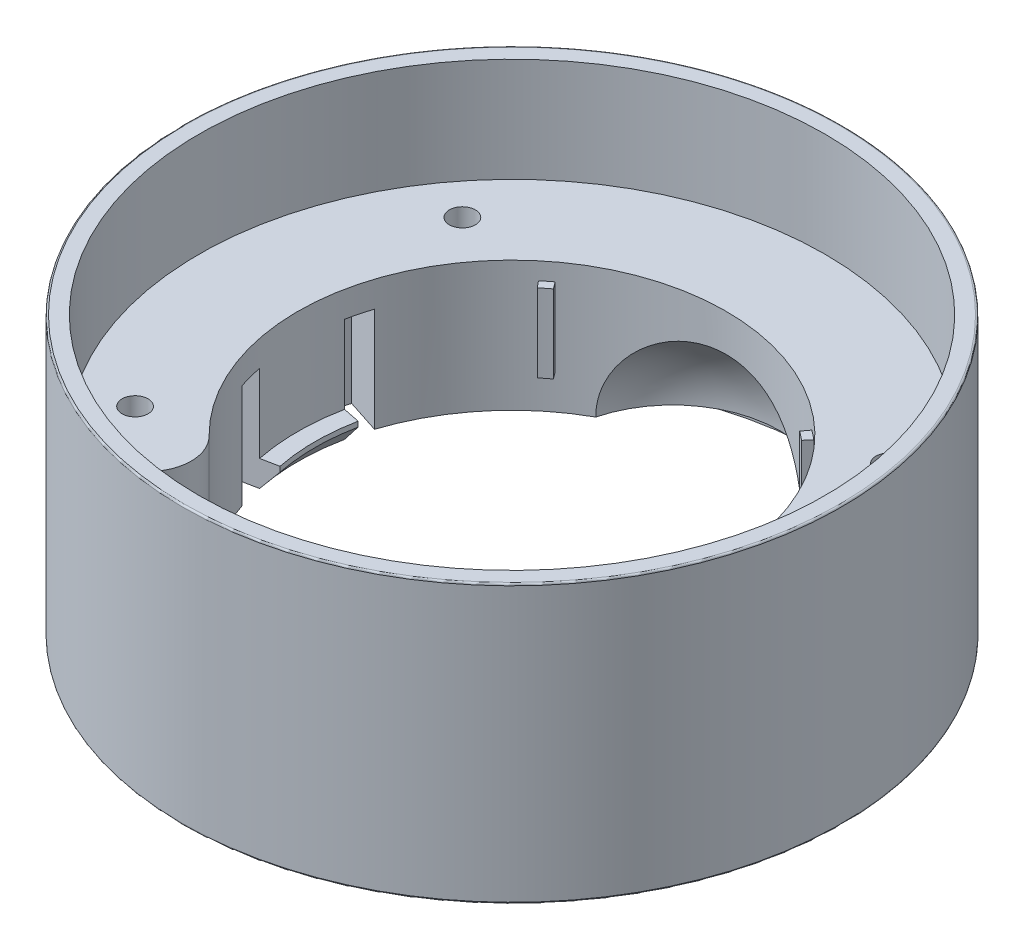
from build123d import *

# Parameters (mm, degrees)
EXTRUDE_1_DEPTH                = 13.5
EXTRUDE_1_DEPTH_BACK           = 2.5
SKETCH_1_R                     = 19
SKETCH_2_R                     = 18.05
CUT_EXTRUDE_1_DEPTH            = 6
CUT_EXTRUDE_START              = -2.5
SKETCH_3_R                     = 18.05
CUT_EXTRUDE_2_DEPTH            = 2.5
SKETCH_4_R                     = 12.35
CUT_EXTRUDE_3_DEPTH            = 11
EXTRUDE_2_DEPTH                = 1.5
EXTRUDE_START                  = -0.5
EXTRUDE_3_DEPTH                = 4.5
CUT_EXTRUDE_4_DEPTH            = 6
EXTRUDE_4_DEPTH                = 1.5
CUT_REVOLVE_12_ANGLE           = 45.0000000000001
CUT_REVOLVE_12_OTHER_WAY_ANGLE = 225.0000000000005
CUT_EXTRUDE_5_DEPTH            = 2.5
EXTRUDE_5_DEPTH                = 0.6
FILLET_11_SIZE                 = 0.4
FILLET_11_SIZE_2               = 1
CUT_EXTRUDE_START_2            = -5
CUT_EXTRUDE_6_DEPTH            = 5
FILLET_13_R                    = 2.5
HOLE_WIZARD_1_5_1_5_1_D        = 1.5
HOLE_WIZARD_1_5_1_5_1_DEPTH    = 2
HOLE_WIZARD_1_5_1_5_1_TIP      = 0.4506454642706702
FILLET_6_R                     = 0.1
FILLET_14_R                    = 0.3


with BuildPart() as part:
    # 草图1 → 凸台-拉伸1 (new, two sides: drawn at the far end of the back side and taken through both)
    with BuildSketch(Plane(origin=(0, 0, 0), x_dir=(1, 0, 0), z_dir=(0, 1, 0)).offset(-EXTRUDE_1_DEPTH_BACK)):
        with Locations(Location((0, 0, 0), (0, 0, 270))):
            Circle(SKETCH_1_R)
    extrude(amount=EXTRUDE_1_DEPTH + EXTRUDE_1_DEPTH_BACK)

    # 草图2 → 切除-拉伸1 (cut)
    with BuildSketch(Plane(origin=(0, 13.5, 0), x_dir=(1, 0, 0), z_dir=(0, 1, 0))):
        with Locations(Location((0, 0, 0), (0, 0, 270))):
            Circle(SKETCH_2_R)
    extrude(amount=-CUT_EXTRUDE_1_DEPTH, mode=Mode.SUBTRACT)

    # 草图3 → 切除-拉伸2 (cut)
    with BuildSketch(Plane(origin=(0, -2.5, 0), x_dir=(-1, 0, 0), z_dir=(0, -1, 0)).offset(CUT_EXTRUDE_START)):
        with Locations(Location((0, 0, 0), (0, 0, 270))):
            Circle(SKETCH_3_R)
    extrude(amount=CUT_EXTRUDE_2_DEPTH, mode=Mode.SUBTRACT)

    # 草图4 → 切除-拉伸3 (cut)
    with BuildSketch(Plane(origin=(0, -2.5, 0), x_dir=(-1, 0, 0), z_dir=(0, -1, 0))):
        with Locations(Location((0, 0, 0), (0, 0, 90))):
            Circle(SKETCH_4_R)
    extrude(amount=-CUT_EXTRUDE_3_DEPTH, mode=Mode.SUBTRACT)

    # 草图6 → 切除-旋转1 (revolve, cut)
    with BuildSketch(Plane.XY, mode=Mode.PRIVATE) as cut_revolve_1_sk:
        with BuildLine():
            Line((-17.5, 0.09999999999999791), (-17.5, -1e-17))
            Line((-17.5, -1e-17), (-16.2, -1e-17))
            Line((-16.2, -1e-17), (-16.2, 0.09999999999999802))
            ThreePointArc((-16.2, 0.09999999999999802), (-16.85, 0.7499999999999966), (-17.5, 0.09999999999999791))
        make_face()
    revolve(cut_revolve_1_sk.sketch.rotate(Axis((0, 0, 0), (0, 1, 0)), 270), axis=Axis((0, 0, 0), (0, 1, 0)), mode=Mode.SUBTRACT)

    # 草图8 → 凸台-拉伸2 (add)
    with BuildSketch(Plane(origin=(0, 0, 0), x_dir=(1, 0, 0), z_dir=(0, 1, 0))):
        with BuildLine():
            Line((-7.083668988935433, -10.116527746969041), (7.083668988935436, -10.116527746969041))
            ThreePointArc((7.083668988935436, -10.116527746969041), (7.6e-16, -12.350000000000001), (-7.083668988935433, -10.116527746969041))
        make_face()
    extrude(amount=EXTRUDE_2_DEPTH)

    # 草图10 → 凸台-拉伸3 (add)
    with BuildSketch(Plane(origin=(0, 1.5, 0), x_dir=(-1, 0, 0), z_dir=(0, -1, 0)).offset(EXTRUDE_START)):
        with BuildLine():
            Line((-7.938426979628755, 9.460648872519387), (-7.617033174785484, 9.077626650959896))
            ThreePointArc((-7.617033174785484, 9.077626650959896), (-7.36186118424343, 9.285768675986384), (-7.101004280987901, 9.486740125111023))
            Line((-7.101004280987901, 9.486740125111023), (-7.400624714784859, 9.887024518575625))
            ThreePointArc((-7.400624714784859, 9.887024518575625), (-7.672488238430918, 9.677573261471045), (-7.938426979628755, 9.460648872519387))
        make_face()
        with BuildLine():
            Line((7.938426979628755, 9.460648872519387), (7.617033174785484, 9.077626650959896))
            ThreePointArc((7.617033174785484, 9.077626650959896), (7.36186118424343, 9.285768675986384), (7.101004280987901, 9.486740125111023))
            Line((7.101004280987901, 9.486740125111023), (7.400624714784859, 9.887024518575625))
            ThreePointArc((7.400624714784859, 9.887024518575625), (7.672488238430917, 9.677573261471045), (7.938426979628755, 9.460648872519387))
        make_face()
    extrude(amount=-EXTRUDE_3_DEPTH)

    # 草图11 → 切除-旋转10 (revolve, cut)
    with BuildSketch(Plane(origin=(0, 0, 0), x_dir=(1, 0, 0), z_dir=(0, 1, 0))):
        with BuildLine():
            Line((-5.978918040707698, 10.806250000000004), (5.978918040707698, 10.806250000000004))
            ThreePointArc((5.978918040707698, 10.806250000000004), (3.8e-16, 15.437499999999998), (-5.978918040707698, 10.806250000000004))
        make_face()
    revolve(axis=Axis((0, 0, -9.2625), (-1, 0, 0)), mode=Mode.SUBTRACT)

    # 草图12 → 切除-拉伸4 (cut)
    with BuildSketch(Plane(origin=(0, 0, 0), x_dir=(1, 0, 0), z_dir=(0, 1, 0))):
        with BuildLine():
            Line((-11.74554797624514, -3.8163598805306145), (-12.104483802376642, -2.4503003648535713))
            Line((-12.104483802376642, -2.4503003648535713), (-13.035597941020999, -2.6387850083038455))
            ThreePointArc((-13.035597941020999, -2.6387850083038455), (-13.3, -1.63e-15), (-13.035597941020999, 2.6387850083038424))
            Line((-13.035597941020999, 2.6387850083038424), (-12.104483802376642, 2.4503003648535713))
            Line((-12.104483802376642, 2.4503003648535713), (-11.74554797624514, 3.8163598805306145))
            Line((-11.74554797624514, 3.8163598805306145), (-13.695213834650207, 4.449844718999256))
            ThreePointArc((-13.695213834650207, 4.449844718999256), (-14.4, -8.16e-15), (-13.695213834650206, -4.44984471899926))
            Line((-13.695213834650206, -4.44984471899926), (-11.74554797624514, -3.8163598805306145))
        make_face()
        with BuildLine():
            Line((13.695213834650206, -4.449844718999256), (11.74554797624514, -3.8163598805306145))
            Line((11.74554797624514, -3.8163598805306145), (12.104483802376642, -2.4503003648535713))
            Line((12.104483802376642, -2.4503003648535713), (13.035597941020999, -2.638785008303843))
            ThreePointArc((13.035597941020999, -2.638785008303843), (13.3, 1.11e-15), (13.035597941020999, 2.638785008303845))
            Line((13.035597941020999, 2.638785008303845), (12.104483802376642, 2.4503003648535713))
            Line((12.104483802376642, 2.4503003648535713), (11.74554797624514, 3.8163598805306145))
            Line((11.74554797624514, 3.8163598805306145), (13.695213834650207, 4.44984471899926))
            ThreePointArc((13.695213834650207, 4.44984471899926), (14.399999999999999, 1.6e-15), (13.695213834650206, -4.449844718999256))
        make_face()
    extrude(amount=CUT_EXTRUDE_4_DEPTH, mode=Mode.SUBTRACT)

    # 草图14 → 凸台-拉伸4 (add)
    with BuildSketch(Plane(origin=(0, 0, 0), x_dir=(1, 0, 0), z_dir=(0, 1, 0))):
        with BuildLine():
            ThreePointArc((11.12436365643521, -2.2518954770111765), (11.349999999999998, -1.58e-15), (11.12436365643521, 2.251895477011174))
            Line((11.12436365643521, 2.251895477011174), (12.104483802376642, 2.4503003648535713))
            ThreePointArc((12.104483802376642, 2.4503003648535713), (12.35, 0), (12.10448380237664, -2.450300364853571))
            Line((12.10448380237664, -2.450300364853571), (11.12436365643521, -2.2518954770111765))
        make_face()
        with BuildLine():
            Line((-12.104483802376642, 2.4503003648535713), (-11.12436365643521, 2.251895477011174))
            ThreePointArc((-11.12436365643521, 2.251895477011174), (-11.349999999999998, -6.43e-15), (-11.12436365643521, -2.2518954770111765))
            Line((-11.12436365643521, -2.2518954770111765), (-12.10448380237664, -2.450300364853571))
            ThreePointArc((-12.10448380237664, -2.450300364853571), (-12.35, -1.51e-15), (-12.104483802376642, 2.4503003648535713))
        make_face()
    extrude(amount=EXTRUDE_4_DEPTH)

    # 草图17 → 切除-旋转12 (revolve, cut)
    with BuildSketch(Plane.XY):
        Polygon((-11.35, 0), (-11.35, 1.2039032637703866), (-12.35, -1.2e-16), align=None)
    revolve(axis=Axis((0, 0, 0), (0, 1, 0)), revolution_arc=CUT_REVOLVE_12_ANGLE, mode=Mode.SUBTRACT)

    # 草图17 → 切除-旋转12 other way (revolve, cut)
    with BuildSketch(Plane.XY):
        Polygon((-11.35, 0), (-11.35, 1.2039032637703866), (-12.35, -1.2e-16), align=None)
    revolve(axis=Axis((0, 0, 0), (0, -1, 0)), revolution_arc=CUT_REVOLVE_12_OTHER_WAY_ANGLE, mode=Mode.SUBTRACT)

    # 草图18 → 切除-拉伸5 (cut)
    with BuildSketch(Plane(origin=(0, 0, 0), x_dir=(1, 0, 0), z_dir=(0, 1, 0))):
        with BuildLine():
            Line((-9.641814145309109, -11.490666646775422), (-8.3240995454502, -9.920275538382782))
            ThreePointArc((-8.3240995454502, -9.920275538382782), (-10.13477563124262, -8.061564544452322), (-11.538534488239353, -5.879176971627146))
            Line((-11.538534488239353, -5.879176971627146), (-13.365097862825511, -6.809857496093215))
            ThreePointArc((-13.365097862825511, -6.809857496093215), (-11.739122352790682, -9.337719549558669), (-9.641814145309109, -11.490666646775422))
        make_face()
        with BuildLine():
            Line((-10.036959095382924, 11.147172382160871), (-8.665241352347259, 9.623725489932214))
            ThreePointArc((-8.665241352347259, 9.623725489932214), (-10.4099463449893, 7.7029550884348215), (-11.736685842119385, 5.472906489553279))
            Line((-11.736685842119385, 5.472906489553279), (-13.59461680554369, 6.339273926123483))
            ThreePointArc((-13.59461680554369, 6.339273926123483), (-12.057852909254018, 8.922341801275856), (-10.036959095382924, 11.147172382160871))
        make_face()
        with BuildLine():
            Line((13.365097862825559, 6.809857496093119), (11.538534488239392, 5.879176971627067))
            ThreePointArc((11.538534488239392, 5.879176971627067), (10.134775631242675, 8.061564544452253), (8.324099545450267, 9.920275538382725))
            Line((8.324099545450267, 9.920275538382725), (9.641814145309189, 11.490666646775352))
            ThreePointArc((9.641814145309189, 11.490666646775352), (11.739122352790748, 9.337719549558585), (13.365097862825559, 6.809857496093119))
        make_face()
        with BuildLine():
            Line((10.036959095382016, -11.147172382161688), (8.665241352346477, -9.623725489932918))
            ThreePointArc((8.665241352346477, -9.623725489932918), (10.409946344988674, -7.702955088435669), (11.73668584211894, -5.4729064895542345))
            Line((11.73668584211894, -5.4729064895542345), (13.594616805543174, -6.339273926124587))
            ThreePointArc((13.594616805543174, -6.339273926124587), (12.057852909253292, -8.922341801276836), (10.036959095382016, -11.147172382161688))
        make_face()
    extrude(amount=CUT_EXTRUDE_5_DEPTH, mode=Mode.SUBTRACT)

    # 草图19 → 凸台-拉伸5 (add)
    with BuildSketch(Plane(origin=(0, 0, 0), x_dir=(1, 0, 0), z_dir=(0, 1, 0))):
        with BuildLine():
            ThreePointArc((-10.95651419593377, -8.715204912926694), (-10.02822720794983, -9.76906643777872), (-8.999026535621834, -10.72462220365706))
            Line((-8.999026535621836, -10.724622203657061), (-8.3240995454502, -9.920275538382782))
            ThreePointArc((-8.3240995454502, -9.920275538382782), (-9.276110167353597, -9.036386454945319), (-10.134775631238742, -8.061564544457195))
            Line((-10.134775631238744, -8.061564544457193), (-10.956514195933774, -8.715204912926694))
        make_face()
        with BuildLine():
            ThreePointArc((-11.253996048641035, 8.327519014518785), (-12.031689761016896, 7.15810320508452), (-12.688309018507407, 5.916655664381993))
            Line((-12.68830901850741, 5.916655664381995), (-11.736685842119355, 5.472906489553341))
            ThreePointArc((-11.736685842119355, 5.472906489553342), (-11.12931302894063, 6.621245464703179), (-10.409946344992958, 7.702955088429878))
            Line((-10.409946344992958, 7.702955088429876), (-11.253996048641037, 8.327519014518785))
        make_face()
        with BuildLine():
            ThreePointArc((11.253996048640747, -8.327519014519178), (12.031689761016644, -7.158103205084936), (12.688309018507205, -5.916655664382435))
            Line((12.688309018507203, -5.916655664382435), (11.736685842119163, -5.472906489553754))
            ThreePointArc((11.736685842119165, -5.472906489553755), (11.129313028940397, -6.621245464703571), (10.40994634499269, -7.702955088430243))
            Line((10.409946344992687, -7.702955088430242), (11.253996048640747, -8.327519014519176))
        make_face()
        with BuildLine():
            ThreePointArc((10.956514195934083, 8.71520491292631), (10.02822720795018, 9.76906643777837), (8.999026535622212, 10.724622203656743))
            Line((8.999026535622214, 10.724622203656743), (8.324099545450547, 9.920275538382489))
            ThreePointArc((8.324099545450547, 9.920275538382489), (9.276110167353913, 9.036386454944992), (10.134775631239028, 8.061564544456838))
            Line((10.134775631239027, 8.061564544456838), (10.956514195934083, 8.71520491292631))
        make_face()
    extrude(amount=EXTRUDE_5_DEPTH)

    # 圆角11
    # an asymmetric fillet: 1, 0.4 mm, written as the material it takes off along each edge
    with BuildSketch(Plane(origin=(-8.178255239107715, 0.6, 6.505277952863138), x_dir=(-1.08e-15, -1, -1.36e-15), z_dir=(-0.7826081568524119, 0, 0.6225146366376222))) as fillet_11_piece_1_section:
        with BuildLine():
            Bezier((FILLET_11_SIZE, 0), (0, -7e-16), (-1.74e-15, FILLET_11_SIZE_2), weights=[1, 0.7071067811865476, 1])
            Line((-1.74e-15, FILLET_11_SIZE_2), (0, 0))
            Line((0, 0), (FILLET_11_SIZE, 0))
        make_face()
    fillet_11_piece_1 = extrude(amount=6.049999999999995, mode=Mode.PRIVATE)
    fillet_11_piece_1 = fillet_11_piece_1 - Plane(origin=(-1.2612e-13, 0.5106656532216078, 1.1058e-13), x_dir=(-0.6427876096872726, 0, 0.7660444431183628), z_dir=(0, -1, 0)) * Cylinder(12.949999999999834, 17, mode=Mode.PRIVATE)
    fillet_11_piece_1 = fillet_11_piece_1 & Plane(origin=(1.5454e-13, 0.5106656532216078, -1.3323e-13), x_dir=(-0.7826081568524123, 0, 0.6225146366376217), z_dir=(0, -1, 0)) * Cylinder(14.000000000000197, 17, mode=Mode.PRIVATE)
    add(fillet_11_piece_1, mode=Mode.SUBTRACT)
    with BuildSketch(Plane(origin=(8.17825523910794, 0.6, -6.505277952862855), x_dir=(-1.08e-15, -1, -1.36e-15), z_dir=(0.7826081568524349, 0, -0.6225146366375932))) as fillet_11_piece_2_section:
        with BuildLine():
            Bezier((FILLET_11_SIZE, 0), (-1.1e-16, 7e-16), (1.74e-15, FILLET_11_SIZE_2), weights=[1, 0.7071067811865476, 1])
            Line((1.74e-15, FILLET_11_SIZE_2), (0, 0))
            Line((0, 0), (FILLET_11_SIZE, 0))
        make_face()
    fillet_11_piece_2 = extrude(amount=6.049999999999998, mode=Mode.PRIVATE)
    fillet_11_piece_2 = fillet_11_piece_2 - Plane(origin=(1.6875e-13, 0.5106656517418073, -1.4611e-13), x_dir=(0.8910065241883722, 0, -0.45399049973953826), z_dir=(0, -1, 0)) * Cylinder(12.94999999999978, 17, mode=Mode.PRIVATE)
    fillet_11_piece_2 = fillet_11_piece_2 & Plane(origin=(8.0647e-13, 0.5106656517418073, -7.6827e-13), x_dir=(0.7826081568524389, 0, -0.6225146366375881), z_dir=(0, -1, 0)) * Cylinder(13.999999999998892, 17, mode=Mode.PRIVATE)
    add(fillet_11_piece_2, mode=Mode.SUBTRACT)
    with BuildSketch(Plane(origin=(-8.400304193449914, 0.6, -6.215898121551521), x_dir=(0, -1, 0), z_dir=(-0.8038568606172173, 0, -0.5948227867513415))) as fillet_11_piece_3_section:
        with BuildLine():
            Bezier((FILLET_11_SIZE, 0), (0, 0), (0, FILLET_11_SIZE_2), weights=[1, 0.7071067811865476, 1])
            Line((0, FILLET_11_SIZE_2), (0, 0))
            Line((0, 0), (FILLET_11_SIZE, 0))
        make_face()
    fillet_11_piece_3 = extrude(amount=6.050000000000003, mode=Mode.PRIVATE)
    fillet_11_piece_3 = fillet_11_piece_3 - Plane(origin=(4.44e-15, 0.5106656517418067, 7.11e-15), x_dir=(-0.6691306063588617, 0, -0.7431448254773912), z_dir=(0, -1, 0)) * Cylinder(12.950000000000008, 17, mode=Mode.PRIVATE)
    fillet_11_piece_3 = fillet_11_piece_3 & Plane(origin=(-6.8212e-13, 0.5106656517418067, -4.0723e-13), x_dir=(-0.8038568606172135, 0, -0.5948227867513464), z_dir=(0, -1, 0)) * Cylinder(13.99999999999921, 17, mode=Mode.PRIVATE)
    add(fillet_11_piece_3, mode=Mode.SUBTRACT)
    with BuildSketch(Plane(origin=(8.400304193449685, 0.6, 6.215898121551829), x_dir=(0, -1, 0), z_dir=(0.8038568606172, 0, 0.5948227867513649))) as fillet_11_piece_4_section:
        with BuildLine():
            Bezier((FILLET_11_SIZE, 0), (0, 0), (0, FILLET_11_SIZE_2), weights=[1, 0.7071067811865476, 1])
            Line((0, FILLET_11_SIZE_2), (0, 0))
            Line((0, 0), (FILLET_11_SIZE, 0))
        make_face()
    fillet_11_piece_4 = extrude(amount=6.0500000000000025, mode=Mode.PRIVATE)
    fillet_11_piece_4 = fillet_11_piece_4 - Plane(origin=(4.619e-14, 0.5106656517418068, 2.931e-14), x_dir=(0.6691306063588006, 0, 0.7431448254774462), z_dir=(0, -1, 0)) * Cylinder(12.949999999999946, 17, mode=Mode.PRIVATE)
    fillet_11_piece_4 = fillet_11_piece_4 & Plane(origin=(-6.4571e-13, 0.5106656517418068, -3.868e-13), x_dir=(0.8038568606171993, 0, 0.5948227867513656), z_dir=(0, -1, 0)) * Cylinder(14.000000000000753, 17, mode=Mode.PRIVATE)
    add(fillet_11_piece_4, mode=Mode.SUBTRACT)

    # 草图22 → 切除-拉伸6 (cut)
    with BuildSketch(Plane(origin=(0, 7.5, 0), x_dir=(1, 0, 0), z_dir=(0, 1, 0)).offset(CUT_EXTRUDE_START_2)):
        with BuildLine():
            Line((-7.0836689889354325, -10.11652774696904), (-8.603646545265708, -12.287280664334864))
            ThreePointArc((-8.603646545265708, -12.287280664334864), (9.2e-16, -14.999999999999998), (8.60364654526571, -12.287280664334862))
            Line((8.60364654526571, -12.287280664334862), (7.083668988935434, -10.116527746969037))
            ThreePointArc((7.083668988935434, -10.116527746969037), (7.6e-16, -12.35), (-7.0836689889354325, -10.11652774696904))
        make_face()
    extrude(amount=CUT_EXTRUDE_6_DEPTH, mode=Mode.SUBTRACT)

    # 圆角13
    fillet_13_edges = [part.edges().sort_by_distance(p)[0] for p in [
        (-7.0836689889354325, 5, 10.116527746969041),
        (7.083668988935435, 5, 10.116527746969037),
    ]]
    fillet(fillet_13_edges, radius=FILLET_13_R)

    # Ø1.5 (1.5) 直径孔1
    with Locations(Plane(origin=(0, 7.5, 0), x_dir=(1, 0, 0), z_dir=(0, 1, 0))):
        with Locations((-12.296976775, -9.43580215), (0, 0), (-12.296976775, 9.43580215), (12.296976775, 9.43580215), (12.296976775, -9.43580215)):
            Hole(HOLE_WIZARD_1_5_1_5_1_D / 2, depth=HOLE_WIZARD_1_5_1_5_1_DEPTH)
            with Locations((0, 0, -(HOLE_WIZARD_1_5_1_5_1_DEPTH + HOLE_WIZARD_1_5_1_5_1_TIP / 2))):  # 118° drill point
                Cone(0, HOLE_WIZARD_1_5_1_5_1_D / 2, HOLE_WIZARD_1_5_1_5_1_TIP, mode=Mode.SUBTRACT)

    # 圆角6
    fillet_6_edges = [part.edges().sort_by_distance(p)[0] for p in [
        (5.82e-15, 13.5, -19),
        (5.82e-15, -2.5, -19),
    ]]
    fillet(fillet_6_edges, radius=FILLET_6_R)

    # 圆角14
    # the kernel refuses this fillet: 0.3 mm, written as the material it takes off along each edge
    with BuildSketch(Plane(origin=(1.4122e-13, 0, 1.2079e-13), x_dir=(0.9063077870362131, 0, 0.4226182617416362), z_dir=(0.4226182617416362, 0, -0.9063077870362131))) as fillet_14_piece_1:
        with BuildLine():
            CenterArc((14.999999999999819 + FILLET_14_R, -FILLET_14_R), FILLET_14_R, 90, 90)
            Line((14.999999999999819, -FILLET_14_R), (14.999999999999819, 0))
            Line((14.999999999999819, 0), (14.999999999999819 + FILLET_14_R, 0))
        make_face()
    revolve(axis=Axis((1.4122e-13, 0, 1.2079e-13), (0, -1, 0)), revolution_arc=22.999999999945288, mode=Mode.SUBTRACT)
    with BuildSketch(Plane(origin=(10.538807050151116, 0, 11.704531001269775), x_dir=(-0.7431448254774479, 0, 0.6691306063587985), z_dir=(-0.6691306063587986, 0, -0.743144825477448))) as fillet_14_piece_2_section:
        with BuildLine():
            CenterArc((FILLET_14_R, FILLET_14_R), FILLET_14_R, 180, 90)
            Line((0, FILLET_14_R), (0, 0))
            Line((0, 0), (FILLET_14_R, 0))
        make_face()
    fillet_14_piece_2 = extrude(amount=3.5500000000000043, mode=Mode.PRIVATE)
    fillet_14_piece_2 = fillet_14_piece_2 - Plane(origin=(4.619e-14, 0.06791740957590545, 2.931e-14), x_dir=(0.6691306063588006, 0, 0.7431448254774462), z_dir=(0, -1, 0)) * Cylinder(12.949999999999946, 9, mode=Mode.PRIVATE)
    fillet_14_piece_2 = fillet_14_piece_2 & Plane(origin=(1.4122e-13, 0.06791740957590545, 1.2079e-13), x_dir=(0.9063077870362132, 0, 0.4226182617416362), z_dir=(0, -1, 0)) * Cylinder(14.99999999999982, 9, mode=Mode.PRIVATE)
    add(fillet_14_piece_2, mode=Mode.SUBTRACT)
    with BuildSketch(Plane(origin=(-2.487e-14, 0, -2.887e-14), x_dir=(-0.9063077870362465, 0, -0.42261826174156464), z_dir=(-0.42261826174156464, 0, 0.9063077870362465))) as fillet_14_piece_3:
        with BuildLine():
            CenterArc((14.999999999999966 + FILLET_14_R, -FILLET_14_R), FILLET_14_R, 90, 90)
            Line((14.999999999999966, -FILLET_14_R), (14.999999999999966, 0))
            Line((14.999999999999966, 0), (14.999999999999966 + FILLET_14_R, 0))
        make_face()
    revolve(axis=Axis((-2.487e-14, 0, -2.887e-14), (0, -1, 0)), revolution_arc=22.99999999994505, mode=Mode.SUBTRACT)
    with BuildSketch(Plane(origin=(-10.53880705015207, 0, -11.704531001268915), x_dir=(0.7431448254773926, 0, -0.66913060635886), z_dir=(0.6691306063588601, 0, 0.7431448254773926))) as fillet_14_piece_4_section:
        with BuildLine():
            CenterArc((FILLET_14_R, FILLET_14_R), FILLET_14_R, 180, 90)
            Line((-1.19e-15, FILLET_14_R), (0, 0))
            Line((0, 0), (FILLET_14_R, 0))
        make_face()
    fillet_14_piece_4 = extrude(amount=3.5500000000000025, mode=Mode.PRIVATE)
    fillet_14_piece_4 = fillet_14_piece_4 - Plane(origin=(4.44e-15, 0.0679174213340134, 7.11e-15), x_dir=(-0.6691306063588617, 0, -0.7431448254773912), z_dir=(0, -1, 0)) * Cylinder(12.950000000000008, 9, mode=Mode.PRIVATE)
    fillet_14_piece_4 = fillet_14_piece_4 & Plane(origin=(-2.487e-14, 0.0679174213340134, -2.887e-14), x_dir=(-0.9063077870362466, 0, -0.42261826174156464), z_dir=(0, -1, 0)) * Cylinder(14.999999999999964, 9, mode=Mode.PRIVATE)
    add(fillet_14_piece_4, mode=Mode.SUBTRACT)
    with BuildSketch(Plane(origin=(2.576e-14, 0, -1.155e-14), x_dir=(0.6427876096872789, 0, -0.7660444431183575), z_dir=(-0.7660444431183575, 0, -0.6427876096872789))) as fillet_14_piece_5:
        with BuildLine():
            CenterArc((14.999999999999973 + FILLET_14_R, -FILLET_14_R), FILLET_14_R, 90, 90)
            Line((14.999999999999973, -FILLET_14_R), (14.999999999999973, 0))
            Line((14.999999999999973, 0), (14.999999999999973 + FILLET_14_R, 0))
        make_face()
    revolve(axis=Axis((2.576e-14, 0, -1.155e-14), (0, -1, 0)), revolution_arc=22.999999999945047, mode=Mode.SUBTRACT)
    with BuildSketch(Plane(origin=(14.033352755966838, 0, -7.150350370897772), x_dir=(0.45399049973953676, 0, 0.8910065241883729), z_dir=(-0.891006524188373, 0, 0.45399049973953687))) as fillet_14_piece_6_section:
        with BuildLine():
            CenterArc((FILLET_14_R, FILLET_14_R), FILLET_14_R, 180, 90)
            Line((0, FILLET_14_R), (0, 0))
            Line((0, 0), (FILLET_14_R, 0))
        make_face()
    fillet_14_piece_6 = extrude(amount=3.550000000000002, mode=Mode.PRIVATE)
    fillet_14_piece_6 = fillet_14_piece_6 - Plane(origin=(1.6875e-13, 0.06791741437648192, -1.4611e-13), x_dir=(0.8910065241883722, 0, -0.45399049973953826), z_dir=(0, -1, 0)) * Cylinder(12.94999999999978, 9, mode=Mode.PRIVATE)
    fillet_14_piece_6 = fillet_14_piece_6 & Plane(origin=(2.576e-14, 0.06791741437648192, -1.155e-14), x_dir=(0.6427876096872788, 0, -0.7660444431183576), z_dir=(0, -1, 0)) * Cylinder(14.999999999999972, 9, mode=Mode.PRIVATE)
    add(fillet_14_piece_6, mode=Mode.SUBTRACT)
    with BuildSketch(Plane(origin=(-5.684e-14, 0, 3.819e-14), x_dir=(-0.8910065241883677, 0, 0.45399049973954714), z_dir=(-0.45399049973954714, 0, -0.8910065241883677))) as fillet_14_piece_7:
        with BuildLine():
            CenterArc((14.999999999999934 + FILLET_14_R, FILLET_14_R), FILLET_14_R, 180, 90)
            Line((14.999999999999934, FILLET_14_R), (14.999999999999934, 0))
            Line((14.999999999999934, 0), (14.999999999999934 + FILLET_14_R, 0))
        make_face()
    revolve(axis=Axis((-5.684e-14, 0, 3.819e-14), (0, 1, 0)), revolution_arc=22.9999999999451, mode=Mode.SUBTRACT)
    with BuildSketch(Plane(origin=(-10.870279595098076, 0, 5.538684096822487), x_dir=(-0.4539904997395451, 0, -0.8910065241883687), z_dir=(-0.8910065241883688, 0, 0.4539904997395452))) as fillet_14_piece_8_section:
        with BuildLine():
            CenterArc((FILLET_14_R, -FILLET_14_R), FILLET_14_R, 90, 90)
            Line((0, -FILLET_14_R), (0, 0))
            Line((0, 0), (FILLET_14_R, 0))
        make_face()
    fillet_14_piece_8 = extrude(amount=3.5500000000000047, mode=Mode.PRIVATE)
    fillet_14_piece_8 = fillet_14_piece_8 & Plane(origin=(-5.684e-14, 0.06791743184412953, 3.819e-14), x_dir=(-0.8910065241883677, 0, 0.45399049973954714), z_dir=(0, -1, 0)) * Cylinder(14.999999999999934, 9, mode=Mode.PRIVATE)
    fillet_14_piece_8 = fillet_14_piece_8 - Plane(origin=(-1.2612e-13, 0.06791743184412953, 1.1058e-13), x_dir=(-0.6427876096872726, 0, 0.7660444431183628), z_dir=(0, -1, 0)) * Cylinder(12.949999999999834, 9, mode=Mode.PRIVATE)
    add(fillet_14_piece_8, mode=Mode.SUBTRACT)
    with BuildSketch(Plane(origin=(10.538807050151116, 0, 11.704531001269775), x_dir=(-0.7431448254774479, 0, 0.6691306063587985), z_dir=(-0.6691306063587986, 0, -0.743144825477448))) as fillet_14_piece_9a_section:
        with BuildLine():
            CenterArc((FILLET_14_R, FILLET_14_R), FILLET_14_R, 180, 90)
            Line((0, FILLET_14_R), (0, 0))
            Line((0, 0), (FILLET_14_R, 0))
        make_face()
    fillet_14_piece_9a = extrude(amount=3.5500000000000043, mode=Mode.PRIVATE)
    fillet_14_piece_9a = fillet_14_piece_9a - Plane(origin=(1.4122e-13, 0.06789914359304482, 1.2079e-13), x_dir=(0.9063077870362132, 0, 0.4226182617416362), z_dir=(0, -1, 0)) * Cylinder(14.99999999999982, 9, mode=Mode.PRIVATE)
    with BuildSketch(Plane(origin=(1.4122e-13, 0, 1.2079e-13), x_dir=(0.9063077870362131, 0, 0.4226182617416362), z_dir=(0.4226182617416362, 0, -0.9063077870362131))) as fillet_14_piece_9b_section:
        with BuildLine():
            CenterArc((14.999999999999819 + FILLET_14_R, -FILLET_14_R), FILLET_14_R, 90, 90)
            Line((14.999999999999819, -FILLET_14_R), (14.999999999999819, 0))
            Line((14.999999999999819, 0), (14.999999999999819 + FILLET_14_R, 0))
        make_face()
    fillet_14_piece_9b = revolve(axis=Axis((1.4122e-13, 0, 1.2079e-13), (0, -1, 0)), revolution_arc=25.86486411363047, mode=Mode.PRIVATE)
    fillet_14_piece_9b = split(fillet_14_piece_9b, bisect_by=Plane(origin=(10.078390442594284, 0.06775453652770234, 11.193186554881875), z_dir=(-0.743144825477448, 0, 0.6691306063587986)), keep=Keep.TOP, mode=Mode.PRIVATE)
    fillet_14_piece_9 = fillet_14_piece_9a & fillet_14_piece_9b
    add(fillet_14_piece_9, mode=Mode.SUBTRACT)
    with BuildSketch(Plane(origin=(-10.53880705015207, 0, -11.704531001268915), x_dir=(0.7431448254773926, 0, -0.66913060635886), z_dir=(0.6691306063588601, 0, 0.7431448254773926))) as fillet_14_piece_10a_section:
        with BuildLine():
            CenterArc((FILLET_14_R, FILLET_14_R), FILLET_14_R, 180, 90)
            Line((-1.19e-15, FILLET_14_R), (0, 0))
            Line((0, 0), (FILLET_14_R, 0))
        make_face()
    fillet_14_piece_10a = extrude(amount=3.5500000000000025, mode=Mode.PRIVATE)
    fillet_14_piece_10a = fillet_14_piece_10a - Plane(origin=(-2.487e-14, 0.06789914359304729, -2.887e-14), x_dir=(-0.9063077870362466, 0, -0.42261826174156464), z_dir=(0, -1, 0)) * Cylinder(14.999999999999964, 9, mode=Mode.PRIVATE)
    with BuildSketch(Plane(origin=(-2.487e-14, 0, -2.887e-14), x_dir=(-0.9063077870362465, 0, -0.42261826174156464), z_dir=(-0.42261826174156464, 0, 0.9063077870362465))) as fillet_14_piece_10b_section:
        with BuildLine():
            CenterArc((14.999999999999966 + FILLET_14_R, -FILLET_14_R), FILLET_14_R, 90, 90)
            Line((14.999999999999966, -FILLET_14_R), (14.999999999999966, 0))
            Line((14.999999999999966, 0), (14.999999999999966 + FILLET_14_R, 0))
        make_face()
    fillet_14_piece_10b = revolve(axis=Axis((-2.487e-14, 0, -2.887e-14), (0, -1, 0)), revolution_arc=25.864864113630215, mode=Mode.PRIVATE)
    fillet_14_piece_10b = split(fillet_14_piece_10b, bisect_by=Plane(origin=(-10.078390441340337, 0.067754536443845, -11.193186553487392), z_dir=(0.7431448254773926, 0, -0.6691306063588601)), keep=Keep.TOP, mode=Mode.PRIVATE)
    fillet_14_piece_10 = fillet_14_piece_10a & fillet_14_piece_10b
    add(fillet_14_piece_10, mode=Mode.SUBTRACT)
    with BuildSketch(Plane(origin=(14.033352755966838, 0, -7.150350370897772), x_dir=(0.45399049973953676, 0, 0.8910065241883729), z_dir=(-0.891006524188373, 0, 0.45399049973953687))) as fillet_14_piece_11a_section:
        with BuildLine():
            CenterArc((FILLET_14_R, FILLET_14_R), FILLET_14_R, 180, 90)
            Line((0, FILLET_14_R), (0, 0))
            Line((0, 0), (FILLET_14_R, 0))
        make_face()
    fillet_14_piece_11a = extrude(amount=3.550000000000002, mode=Mode.PRIVATE)
    fillet_14_piece_11a = fillet_14_piece_11a - Plane(origin=(2.576e-14, 0.06789914359304756, -1.155e-14), x_dir=(0.6427876096872788, 0, -0.7660444431183576), z_dir=(0, -1, 0)) * Cylinder(14.999999999999972, 9, mode=Mode.PRIVATE)
    with BuildSketch(Plane(origin=(2.576e-14, 0, -1.155e-14), x_dir=(0.6427876096872789, 0, -0.7660444431183575), z_dir=(-0.7660444431183575, 0, -0.6427876096872789))) as fillet_14_piece_11b_section:
        with BuildLine():
            CenterArc((14.999999999999973 + FILLET_14_R, -FILLET_14_R), FILLET_14_R, 90, 90)
            Line((14.999999999999973, -FILLET_14_R), (14.999999999999973, 0))
            Line((14.999999999999973, 0), (14.999999999999973 + FILLET_14_R, 0))
        make_face()
    fillet_14_piece_11b = revolve(axis=Axis((2.576e-14, 0, -1.155e-14), (0, -1, 0)), revolution_arc=25.86486411363022, mode=Mode.PRIVATE)
    fillet_14_piece_11b = split(fillet_14_piece_11b, bisect_by=Plane(origin=(13.42026736178766, 0.06775453596325902, -6.837967759850165), z_dir=(0.4539904997395369, 0, 0.8910065241883731)), keep=Keep.TOP, mode=Mode.PRIVATE)
    fillet_14_piece_11 = fillet_14_piece_11a & fillet_14_piece_11b
    add(fillet_14_piece_11, mode=Mode.SUBTRACT)
    with BuildSketch(Plane(origin=(-5.684e-14, 0, 3.819e-14), x_dir=(-0.9125836023023264, 0, 0.4088901671707322), z_dir=(-0.4088901671707322, 0, -0.9125836023023264))) as fillet_14_piece_12a_section:
        with BuildLine():
            CenterArc((14.999999999999934 + FILLET_14_R, FILLET_14_R), FILLET_14_R, 180, 90)
            Line((14.999999999999934, FILLET_14_R), (14.999999999999934, 0))
            Line((14.999999999999934, 0), (14.999999999999934 + FILLET_14_R, 0))
        make_face()
    fillet_14_piece_12a = revolve(axis=Axis((-5.684e-14, 0, 3.819e-14), (0, 1, 0)), revolution_arc=25.864864113630272, mode=Mode.PRIVATE)
    fillet_14_piece_12a = split(fillet_14_piece_12a, bisect_by=Plane(origin=(-13.42026772694312, 0.06775442192030796, 6.837967945906286), z_dir=(-0.4539904997395452, 0, -0.8910065241883688)), keep=Keep.TOP, mode=Mode.PRIVATE)
    with BuildSketch(Plane(origin=(-10.870279595098076, 0, 5.538684096822487), x_dir=(-0.4539904997395451, 0, -0.8910065241883687), z_dir=(-0.8910065241883688, 0, 0.4539904997395452))) as fillet_14_piece_12b_section:
        with BuildLine():
            CenterArc((FILLET_14_R, -FILLET_14_R), FILLET_14_R, 90, 90)
            Line((0, -FILLET_14_R), (0, 0))
            Line((0, 0), (FILLET_14_R, 0))
        make_face()
    fillet_14_piece_12b = extrude(amount=3.5500000000000047, mode=Mode.PRIVATE)
    fillet_14_piece_12b = fillet_14_piece_12b - Plane(origin=(-5.684e-14, 0.06789916580575853, 3.819e-14), x_dir=(-0.8910065241883677, 0, 0.45399049973954714), z_dir=(0, -1, 0)) * Cylinder(14.999999999999934, 9, mode=Mode.PRIVATE)
    fillet_14_piece_12 = fillet_14_piece_12a & fillet_14_piece_12b
    add(fillet_14_piece_12, mode=Mode.SUBTRACT)


solid = part.part
